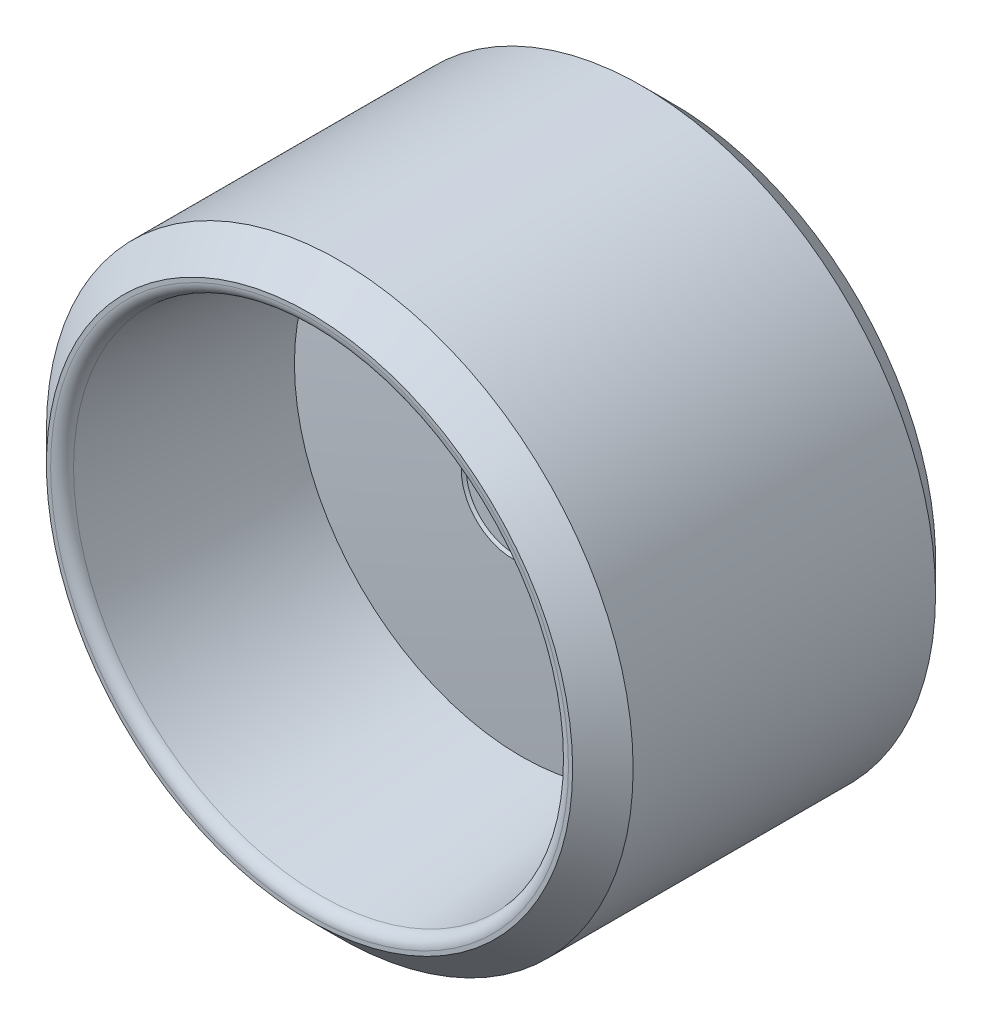
from build123d import *

# Parameters (mm, degrees)
CHAMFER_1_SIZE      = 1
FILLET_1_R          = 0.4
SKETCH_2_R          = 1.5
CUT_EXTRUDE_1_DEPTH = 6.8
CHAMFER_2_SIZE      = 0.2
CHAMFER_2_SIZE_2    = 0.196621941


with BuildPart() as part:
    # 스케치1 → 회전1 (revolve)
    with BuildSketch(Plane(origin=(0, 0, 0), x_dir=(1, 0, 0), z_dir=(0, 1, 0))):
        with BuildLine():
            Line((0, 0), (4, 0))
            Line((4, 0), (5.894700278586023, 2))
            Line((5.894700278586023, 2), (9.7, 2))
            Line((9.7, 2), (9.7, -10))
            Line((9.7, -10), (8.2, -9.999999999999998))
            Line((8.2, -9.999999999999998), (7.5, -2.999999999999999))
            ThreePointArc((7.5, -2.999999999999999), (3.75282938430565, -3.220734607641745), (0, -3.3))
            Line((0, -3.3), (0, -3))
            Line((0, -3), (0, 0))
        make_face()
    revolve(axis=Axis((0, 0, 3), (0, 0, -1)))

    # 모따기1
    chamfer_1_edges = [part.edges().sort_by_distance(p)[0] for p in [
        (-9.7, -1.19e-15, 10),
        (-9.7, -1.19e-15, -2),
    ]]
    chamfer(chamfer_1_edges, length=CHAMFER_1_SIZE)

    # 필렛1
    fillet_1_edges = [part.edges().sort_by_distance(p)[0] for p in [
        (-8.2, -1e-15, 9.999999999999998),
        (-5.894700278586023, -7.2e-16, -2),
    ]]
    fillet(fillet_1_edges, radius=FILLET_1_R)

    # 스케치2 → 컷-돌출1 (cut)
    with BuildSketch(Plane.XY.offset(10)):
        Circle(SKETCH_2_R)
    extrude(amount=-CUT_EXTRUDE_1_DEPTH, mode=Mode.SUBTRACT)

    # 모따기2
    # the kernel refuses this chamfer: 0.2, 0.196621941 mm, written as the material it takes off along each edge
    with BuildSketch(Plane(origin=(2.26883e-11, 1.9670789e-10, 3.2853073545034164), x_dir=(1.0, -1.3113829668845467e-10, 0), z_dir=(-1.3113829668845467e-10, -1.0, 0))) as chamfer_2_piece_1_section:
        with BuildLine():
            Line((1.499999999977312 + CHAMFER_2_SIZE * 0.999831893416, -CHAMFER_2_SIZE * 0.0183353458825), (1.5000000000226883, -CHAMFER_2_SIZE_2 * 1.00000000195))
            Line((1.5000000000226883, -CHAMFER_2_SIZE_2 * 1.00000000195), (1.499999999977312, 0))
            ThreePointArc((1.499999999977312, 0), (1.6028105859636501, -0.00183517420042278), (1.499999999977312 + CHAMFER_2_SIZE * 0.999831893416, -CHAMFER_2_SIZE * 0.0183353458825))
        make_face()
    chamfer_2_piece_1 = revolve(axis=Axis((2.26883e-11, 1.9670789e-10, 3.2853073545034164), (0, 0, 1)), mode=Mode.PRIVATE)
    chamfer_2_piece_1 = split(chamfer_2_piece_1, bisect_by=Plane(origin=(2.26883e-11, 1.9670789e-10, 3.2), z_dir=(0, 0, 1)), keep=Keep.TOP, mode=Mode.PRIVATE)
    add(chamfer_2_piece_1, mode=Mode.SUBTRACT)


solid = part.part
